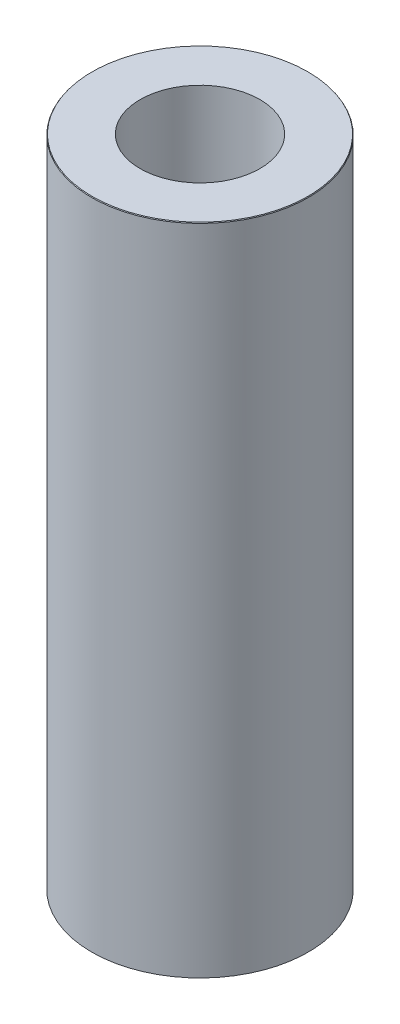
from build123d import *
from OCP.BRepFilletAPI import BRepFilletAPI_MakeChamfer

# Parameters (mm, degrees)
SKETCH1_R           = 35
BOSS_EXTRUDE1_DEPTH = 211.440433749
SKETCH2_R           = 19.341865001
CUT_EXTRUDE1_DEPTH  = 218.1567568
CHAMFER1_SIZE       = 0.255085319
CHAMFER1_SIZE2      = 0.147273578


with BuildPart() as part:
    # Sketch1 → Boss-Extrude1 (new body)
    with BuildSketch(Plane(origin=(0, 0, 0), x_dir=(1, 0, 0), z_dir=(0, 1, 0))):
        Circle(SKETCH1_R)
    extrude(amount=BOSS_EXTRUDE1_DEPTH)

    # Sketch2 → Cut-Extrude1 (cut, through all)
    with BuildSketch(Plane(origin=(0, 0, 0), x_dir=(1, 0, 0), z_dir=(0, 1, 0))):
        Circle(SKETCH2_R)
    extrude(amount=CUT_EXTRUDE1_DEPTH, mode=Mode.SUBTRACT)

    # Chamfer1: one chamfer whose edges measure the first distance from different faces: ONE call of the kernel's chamfer builder (chamfer() names one face for all edges)
    chamfer1_edges_1 = [part.edges().sort_by_distance(p)[0] for p in [
        (-35, 211.440433749, 0),
    ]]
    chamfer1_side_1 = [part.faces().sort_by_distance(p)[0] for p in [
        (-35, 105.720216874, 0),
    ]]
    chamfer1_edges_2 = [part.edges().sort_by_distance(p)[0] for p in [
        (-35, 0, 0),
    ]]
    chamfer1_side_2 = [part.faces().sort_by_distance(p)[0] for p in [
        (-34.010050506, 0, 0),
    ]]
    chamfer1 = BRepFilletAPI_MakeChamfer(part.part.solid().wrapped)
    for e in chamfer1_edges_1:
        chamfer1.Add(CHAMFER1_SIZE, CHAMFER1_SIZE2, e.wrapped, chamfer1_side_1[0].wrapped)  # the first distance lies on this face
    for e in chamfer1_edges_2:
        chamfer1.Add(CHAMFER1_SIZE, CHAMFER1_SIZE2, e.wrapped, chamfer1_side_2[0].wrapped)  # the first distance lies on this face
    add(Compound.cast(chamfer1.Shape()), mode=Mode.REPLACE)


solid = part.part
